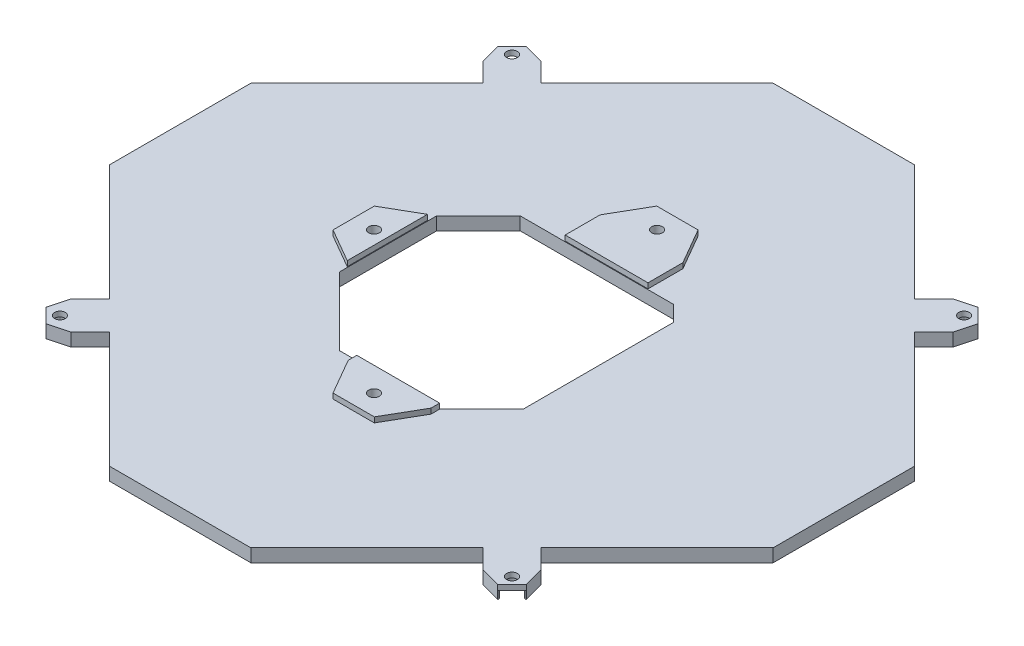
from build123d import *

# Parameters (mm, degrees)
BOSS_EXTRUDE1_DEPTH = 4.95
SKETCH2_R           = 2.05
CUT_EXTRUDE1_DEPTH  = 179.606105426
BOSS_EXTRUDE2_START = 2
SKETCH4_R           = 2.05
BOSS_EXTRUDE2_DEPTH = 2
SKETCH5_R           = 3.375
CUT_EXTRUDE2_DEPTH  = 3
FILLET1_R           = 1


with BuildPart() as part:
    # Sketch1 → Boss-Extrude1 (new body)
    with BuildSketch(Plane(origin=(0, -273.846152423, 0), x_dir=(-1, 0, 0), z_dir=(0, -1, 0))):
        Polygon((82.019978644, 71.058996872), (82.302821357, 71.341839584), (89.377289978, 78.416308206), (91.393147439, 85.939590671), (85.940417335, 91.392320775), (78.41713487, 89.376463314), (71.342666248, 82.301994692), (71.059823536, 82.01915198), (26.834314575, 126.244660941), (-26.834314575, 126.244660941), (-71.058996872, 82.019978644), (-71.341839584, 82.302821357), (-78.416308206, 89.377289978), (-85.939590671, 91.393147439), (-91.392320775, 85.940417335), (-89.376463314, 78.41713487), (-82.301994692, 71.342666248), (-82.01915198, 71.059823536), (-126.244660941, 26.834314575), (-126.244660941, -26.834315555), (-82.020164054, -71.059182282), (-82.302821357, -71.341839584), (-89.377289978, -78.416308206), (-91.393147439, -85.939590671), (-85.940417335, -91.392320775), (-78.41713487, -89.376463314), (-71.342666248, -82.301994692), (-71.060054774, -82.019383219), (-26.834316916, -126.245490927), (26.834310282, -126.245490927), (71.059226271, -82.020208043), (71.341839584, -82.302821357), (78.416308206, -89.377289978), (85.939590671, -91.393147439), (91.392320775, -85.940417335), (89.376463314, -78.41713487), (82.301994692, -71.342666248), (82.019335916, -71.060007471), (126.244660941, -26.834315547), (126.244660941, 26.834314575), align=None)
        Polygon((-32.999177325, -28.496194078), (-32.999177325, -5.25), (-32.999177325, 5.25), (-32.999177325, 28.496194078), (-27.095371402, 34.4), (31.271815024, 34.4), (47.175620946, 18.496194078), (47.175620946, -18.496194078), (21.271815024, -44.4), (-17.095371403, -44.4), align=None, mode=Mode.SUBTRACT)
    extrude(amount=-BOSS_EXTRUDE1_DEPTH)

    # Sketch2 → Cut-Extrude1 (cut, through all)
    with BuildSketch(Plane(origin=(0, -268.896152423, 0), x_dir=(1, 0, 0), z_dir=(0, 1, 0))):
        with Locations(Location((-86.015131958, 86.014305294, 0), (0, 0, 180))):
            Circle(SKETCH2_R)
        with Locations(Location((86.014305294, 86.015131958, 0), (0, 0, 180))):
            Circle(SKETCH2_R)
        with Locations(Location((86.015135278, -86.01513528, 0), (0, 0, 180))):
            Circle(SKETCH2_R)
        with Locations(Location((-86.015036236, -86.015036236, 0), (0, 0, 180))):
            Circle(SKETCH2_R)
        with Locations(Location((1.349177325, 53.85640646, 0), (0, 0, 180))):
            Circle(SKETCH2_R)
        with Locations(Location((-52.507229136, 0, 0), (0, 0, 180))):
            Circle(SKETCH2_R)
        with Locations(Location((1.349177325, -53.856406461, 0), (0, 0, 180))):
            Circle(SKETCH2_R)
    extrude(amount=-CUT_EXTRUDE1_DEPTH, mode=Mode.SUBTRACT)

    # Sketch4 → Boss-Extrude2 (add)
    # profile 1 of 3: a face of its own
    with BuildSketch(Plane(origin=(0, -268.896152423, 0), x_dir=(1, 0, 0), z_dir=(0, 1, 0)).offset(BOSS_EXTRUDE2_START)):
        Polygon((17.099177325, 47.933012702), (17.099177325, 34.65), (-14.400822675, 34.65), (-14.400822675, 47.933012702), (-6.506485108, 61.60640646), (9.204839757, 61.60640646), align=None)
        with Locations(Location((1.349177325, 53.85640646, 0), (0, 0, 180))):
            Circle(SKETCH4_R, mode=Mode.SUBTRACT)
    # profile 2 of 3: a face of its own
    with BuildSketch(Plane(origin=(0, -268.896152423, 0), x_dir=(1, 0, 0), z_dir=(0, 1, 0)).offset(BOSS_EXTRUDE2_START)):
        Polygon((-60.257229136, 7.855662432), (-60.257229136, -7.855662433), (-47.425620946, -15.263994875), (-47.425620946, 15.263994875), align=None)
        with Locations(Location((-52.507229136, 0, 0), (0, 0, 180))):
            Circle(SKETCH4_R, mode=Mode.SUBTRACT)
    # profile 3 of 3: a face of its own
    with BuildSketch(Plane(origin=(0, -268.896152423, 0), x_dir=(1, 0, 0), z_dir=(0, 1, 0)).offset(BOSS_EXTRUDE2_START)):
        Polygon((-14.400822675, -44.65), (17.099177325, -44.65), (17.099177325, -47.933012702), (9.204839758, -61.606406461), (-6.506485108, -61.606406461), (-14.400822675, -47.933012702), align=None)
        with Locations(Location((1.349177325, -53.856406461, 0), (0, 0, 180))):
            Circle(SKETCH4_R, mode=Mode.SUBTRACT)
    extrude(amount=-BOSS_EXTRUDE2_DEPTH)

    # Sketch5 → Cut-Extrude2 (cut)
    with BuildSketch(Plane.XZ.offset(273.846152423)):
        with Locations(Location((1.349177325, 53.856406461, 0), (0, 0, 270))):
            Circle(SKETCH5_R)
        with Locations(Location((-52.507229136, 0, 0), (0, 0, 270))):
            Circle(SKETCH5_R)
        with Locations(Location((1.349177325, -53.85640646, 0), (0, 0, 270))):
            Circle(SKETCH5_R)
        with BuildLine():
            Line((83.628649892, 88.401620667), (86.279883668, 91.052854443))
            Line((86.279883668, 91.052854443), (91.052854441, 86.27988367))
            Line((91.052854441, 86.27988367), (88.401620665, 83.628649894))
            ThreePointArc((88.401620665, 83.628649894), (83.628649892, 83.628649894), (83.628649892, 88.401620667))
        make_face()
        with BuildLine():
            Line((88.401620667, -83.628649892), (91.052854443, -86.279883668))
            Line((91.052854443, -86.279883668), (86.27988367, -91.052854441))
            Line((86.27988367, -91.052854441), (83.628649894, -88.401620665))
            ThreePointArc((83.628649894, -88.401620665), (83.628649894, -83.628649892), (88.401620667, -83.628649892))
        make_face()
        with BuildLine():
            Line((-83.628649892, -88.401620667), (-86.279883668, -91.052854443))
            Line((-86.279883668, -91.052854443), (-91.052854441, -86.27988367))
            Line((-91.052854441, -86.27988367), (-88.401620665, -83.628649894))
            ThreePointArc((-88.401620665, -83.628649894), (-83.628649892, -83.628649894), (-83.628649892, -88.401620667))
        make_face()
        with BuildLine():
            Line((-88.401620667, 83.628649892), (-91.052854443, 86.279883668))
            Line((-91.052854443, 86.279883668), (-86.27988367, 91.052854441))
            Line((-86.27988367, 91.052854441), (-83.628649894, 88.401620665))
            ThreePointArc((-83.628649894, 88.401620665), (-83.628649894, 83.628649892), (-88.401620667, 83.628649892))
        make_face()
    extrude(amount=-CUT_EXTRUDE2_DEPTH, mode=Mode.SUBTRACT)

    # Fillet1
    # the kernel refuses this fillet: 1 mm, written as the material it takes off along each edge
    with BuildSketch(Plane(origin=(86.27988367, -275.983462791, -91.052854441), x_dir=(-0.7071067811867837, 0, -0.7071067811863112), z_dir=(0, 1, 0)), Plane(origin=(-91.052854441, -275.983462791, -86.27988367), x_dir=(-0.7071067811863703, 0, 0.7071067811867247), z_dir=(0, 1, 0)), Plane(origin=(-86.27988367, -275.983462791, 91.052854441), x_dir=(0.7071067811867394, 0, 0.7071067811863555), z_dir=(0, 1, 0)), Plane(origin=(91.052854441, -275.983462791, 86.27988367), x_dir=(0.7071067811863704, 0, -0.7071067811867248), z_dir=(0, 1, 0))) as fillet1_piece_1:
        with BuildLine():
            CenterArc((1, 0.854924147), FILLET1_R, 180, 58.751355935)
            Line((0, 0.854924147), (-0.02, 0.854924147))
            Line((-0.02, 0.854924147), (-0.02, 0))
            Line((-0.02, 0), (0, -0.02))
            ThreePointArc((0, -0.02), (0.240623487, -0.02), (0.470871913, -0.017098483))
            Line((0.470871913, -0.017098483), (0.481246974, 0))
        make_face()
    extrude(amount=5.137310369, mode=Mode.SUBTRACT)
    with BuildSketch(Plane(origin=(91.052854443, -275.981686608, -86.279883668), x_dir=(0.7071067811863996, 0, 0.7071067811866956), z_dir=(0, 1, 0)), Plane(origin=(-86.279883668, -275.981686608, -91.052854443), x_dir=(0.7071067811866807, 0, -0.7071067811864143), z_dir=(0, 1, 0)), Plane(origin=(-91.052854443, -275.981686608, 86.279883668), x_dir=(-0.7071067811863847, 0, -0.7071067811867103), z_dir=(0, 1, 0)), Plane(origin=(86.279883668, -275.981686608, 91.052854443), x_dir=(-0.7071067811866955, 0, 0.7071067811863995), z_dir=(0, 1, 0))) as fillet1_piece_2:
        with BuildLine():
            CenterArc((1, -0.854213674), FILLET1_R, 121.327026837, 58.672973163)
            Line((0, -0.854213674), (-0.02, -0.854213674))
            Line((-0.02, -0.854213674), (-0.02, 0))
            Line((-0.02, 0), (0, 0.02))
            ThreePointArc((0, 0.02), (0.240038946, 0.02), (0.469679449, 0.017084273))
            Line((0.469679449, 0.017084273), (0.480077891, 0))
        make_face()
    extrude(amount=5.135534185, mode=Mode.SUBTRACT)


solid = part.part
